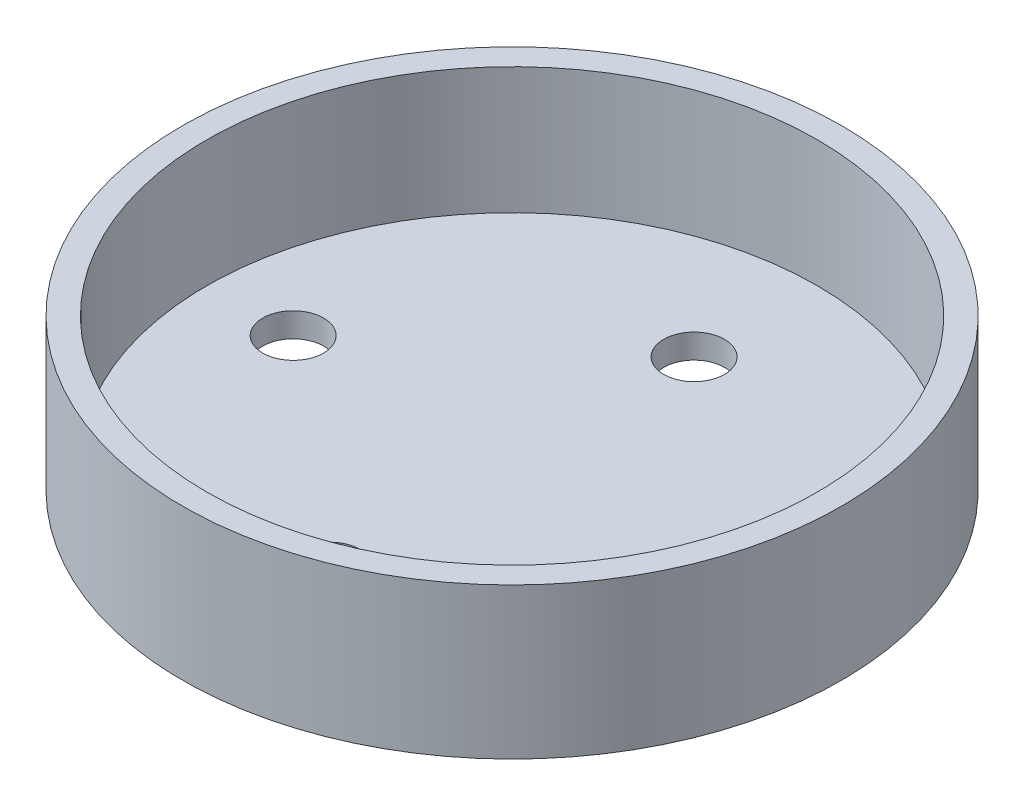
from build123d import *

# Parameters (mm, degrees)
SKETCH1_R                 = 13.55
BOSS_EXTRUDE1_DEPTH       = 6.2
SHELL1_T                  = -1
M3X0_5_TAPPED_HOLE1_D     = 2.5
M3X0_5_TAPPED_HOLE1_DEPTH = 7.5
M3X0_5_TAPPED_HOLE1_TIP   = 0.751075774


with BuildPart() as part:
    # Sketch1 → Boss-Extrude1 (new body)
    with BuildSketch(Plane(origin=(0, 0, 0), x_dir=(1, 0, 0), z_dir=(0, 1, 0))):
        Circle(SKETCH1_R)
    extrude(amount=BOSS_EXTRUDE1_DEPTH)

    # Shell1
    shell1_openings = [part.faces().sort_by_distance(p)[0] for p in [
        (0, 6.2, 0),
    ]]
    offset(amount=SHELL1_T, openings=shell1_openings, kind=Kind.INTERSECTION)

    # M3x0.5 Tapped Hole1
    with Locations(Plane(origin=(0, 0, 0), x_dir=(-1, 0, 0), z_dir=(0, -1, 0))):
        with Locations((9, 0), (0, -7.483104532), (-9, 0), (0, 7.483104532)):
            Hole(M3X0_5_TAPPED_HOLE1_D / 2, depth=M3X0_5_TAPPED_HOLE1_DEPTH)
            with Locations((0, 0, -(M3X0_5_TAPPED_HOLE1_DEPTH + M3X0_5_TAPPED_HOLE1_TIP / 2))):  # 118° drill point
                Cone(0, M3X0_5_TAPPED_HOLE1_D / 2, M3X0_5_TAPPED_HOLE1_TIP, mode=Mode.SUBTRACT)


solid = part.part
